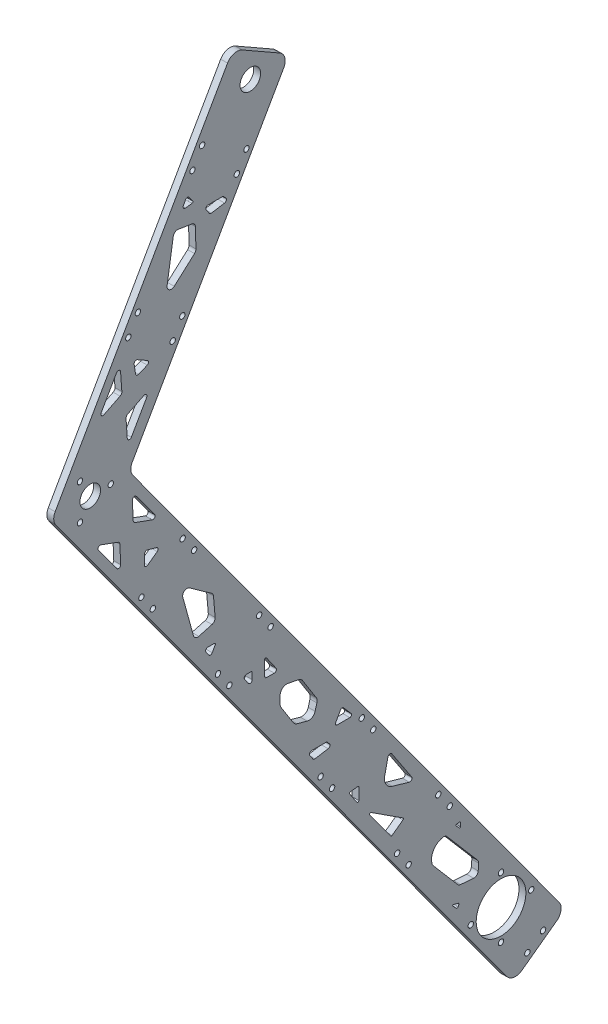
from build123d import *

# Parameters (mm, degrees)
SKETCH3_R                           = 4.765
SKETCH3_R_2                         = 11.5
BOSS_ROCKER_BASE_DEPTH              = 3.18
SKETCH4_R                           = 1.25
CUT_MOTOR_HOLES_SHAFT_SUPPORT_DEPTH = 3.18
SKETCH5_R                           = 1.25
CUT_SUPPORT_HOLES_DEPTH             = 3.18
CUT_LIGHTENING_HOLES_DEPTH          = 3.18


with BuildPart() as part:
    # Sketch3 → Boss-rocker base (new body)
    with BuildSketch(Plane.YZ):
        with BuildLine():
            Line((-3.626649793, 206.112706863), (-289.03382674, -2.652716496))
            ThreePointArc((-289.03382674, -2.652716496), (-291.022843538, -5.922039532), (-290.117530314, -9.640247287))
            Line((-290.117530314, -9.640247287), (-278.309875879, -25.782716018))
            ThreePointArc((-278.309875879, -25.782716018), (-275.040552842, -27.771732816), (-271.322345088, -26.866419592))
            Line((-271.322345088, -26.866419592), (-1.602441241, 170.424309102))
            ThreePointArc((-1.602441241, 170.424309102), (1.066332673, 171.380668673), (3.826130086, 170.732211983))
            Line((3.826130086, 170.732211983), (126.91354691, 100.548260636))
            ThreePointArc((126.91354691, 100.548260636), (130.710275653, 100.069186741), (133.733724692, 102.415122982))
            Line((133.733724692, 102.415122982), (143.640355564, 119.789203239))
            ThreePointArc((143.640355564, 119.789203239), (144.119429459, 123.585931982), (141.773493218, 126.609381021))
            Line((141.773493218, 126.609381021), (1.801921534, 206.420609744))
            ThreePointArc((1.801921534, 206.420609744), (-0.957875878, 207.069066434), (-3.626649793, 206.112706863))
        make_face()
        with Locations((0, 190.180957093)):
            Circle(SKETCH3_R, mode=Mode.SUBTRACT)
        with Locations((-260, 0)):
            Circle(SKETCH3_R_2, mode=Mode.SUBTRACT)
        with Locations((130, 116.055478547)):
            Circle(SKETCH3_R, mode=Mode.SUBTRACT)
    extrude(amount=BOSS_ROCKER_BASE_DEPTH)

    # Sketch4 → Cut-motor holes + shaft support (cut)
    with BuildSketch(Plane.YZ):
        with Locations((-260, -14)):
            Circle(SKETCH4_R)
        with Locations((-260, 14)):
            Circle(SKETCH4_R)
        with Locations((-274, 0)):
            Circle(SKETCH4_R)
        with Locations((-246, 0)):
            Circle(SKETCH4_R)
        with Locations((0, 180.656752709)):
            Circle(SKETCH4_R)
        with Locations((-8.24, 194.928851363)):
            Circle(SKETCH4_R)
        with Locations((8.24, 194.928851363)):
            Circle(SKETCH4_R)
    extrude(amount=CUT_MOTOR_HOLES_SHAFT_SUPPORT_DEPTH, mode=Mode.SUBTRACT)

    # Sketch5 → Cut-support holes (cut)
    with BuildSketch(Plane.YZ):
        with Locations((-173.097097557, 78.211050768)):
            Circle(SKETCH5_R)
        with Locations((-165.832986628, 83.524495264)):
            Circle(SKETCH5_R)
        with Locations((-159.140450015, 59.130652728)):
            Circle(SKETCH5_R)
        with Locations((-151.876339086, 64.444097223)):
            Circle(SKETCH5_R)
        with Locations((-86.902902443, 111.969906325)):
            Circle(SKETCH5_R)
        with Locations((-94.167013372, 106.656461829)):
            Circle(SKETCH5_R)
        with Locations((-100.859549985, 131.050304365)):
            Circle(SKETCH5_R)
        with Locations((-108.123660914, 125.73685987)):
            Circle(SKETCH5_R)
        with Locations((-221.524503751, 42.788087462)):
            Circle(SKETCH5_R)
        with Locations((-214.260392822, 48.101531958)):
            Circle(SKETCH5_R)
        with Locations((-200.30374528, 29.021133918)):
            Circle(SKETCH5_R)
        with Locations((-207.567856209, 23.707689422)):
            Circle(SKETCH5_R)
        with Locations((-38.475496249, 147.392869631)):
            Circle(SKETCH5_R)
        with Locations((-45.739607178, 142.079425135)):
            Circle(SKETCH5_R)
        with Locations((-59.69625472, 161.159823175)):
            Circle(SKETCH5_R)
        with Locations((-52.432143791, 166.473267671)):
            Circle(SKETCH5_R)
        with Locations((95.189202735, 122.297979862)):
            Circle(SKETCH5_R)
        with Locations((103.007538851, 117.839995969)):
            Circle(SKETCH5_R)
        with Locations((114.717176541, 138.376158833)):
            Circle(SKETCH5_R)
        with Locations((106.898840426, 142.834142725)):
            Circle(SKETCH5_R)
        with Locations((62.594935771, 168.096051448)):
            Circle(SKETCH5_R)
        with Locations((50.885298081, 147.559888585)):
            Circle(SKETCH5_R)
        with Locations((43.066961965, 152.017872477)):
            Circle(SKETCH5_R)
        with Locations((54.776599656, 172.554035341)):
            Circle(SKETCH5_R)
        with Locations((-284.303772817, -12.202009133)):
            Circle(SKETCH5_R)
        with Locations((-278.990328321, -19.466120062)):
            Circle(SKETCH5_R)
    extrude(amount=CUT_SUPPORT_HOLES_DEPTH, mode=Mode.SUBTRACT)

    # Sketch6 → Cut-lightening holes (cut)
    with BuildSketch(Plane.YZ):
        with BuildLine():
            Line((-10.769787121, 168.850828722), (-22.35849324, 160.358178067))
            ThreePointArc((-22.35849324, 160.358178067), (-23.549370942, 160.364603578), (-23.889631154, 161.505854634))
            Line((-23.889631154, 161.505854634), (-21.056425779, 169.314282813))
            ThreePointArc((-21.056425779, 169.314282813), (-20.533401198, 170.012282567), (-19.71045993, 170.301291285))
            Line((-19.71045993, 170.301291285), (-11.403614469, 170.656510937))
            ThreePointArc((-11.403614469, 170.656510937), (-10.417332829, 169.988630178), (-10.769787121, 168.850828722))
        make_face()
        with BuildLine():
            Line((-79.983471427, 142.368791683), (-61.979782767, 147.316428458))
            ThreePointArc((-61.979782767, 147.316428458), (-59.811067724, 146.534457497), (-59.819745898, 144.229088067))
            Line((-59.819745898, 144.229088067), (-67.122963599, 133.95613022))
            ThreePointArc((-67.122963599, 133.95613022), (-67.760393878, 133.378682327), (-68.581402, 133.122344477))
            Line((-68.581402, 133.122344477), (-77.604831251, 132.34516891))
            ThreePointArc((-77.604831251, 132.34516891), (-78.919471752, 132.69660063), (-79.704956379, 133.807815192))
            Line((-79.704956379, 133.807815192), (-81.381998087, 139.910311831))
            ThreePointArc((-81.381998087, 139.910311831), (-81.191902606, 141.429196112), (-79.983471427, 142.368791683))
        make_face()
        with BuildLine():
            Line((-23.590243446, 186.37791816), (-35.194117114, 177.906003349))
            ThreePointArc((-35.194117114, 177.906003349), (-35.548706119, 176.769122694), (-34.564130708, 176.099165796))
            Line((-34.564130708, 176.099165796), (-26.264347501, 176.434131554))
            ThreePointArc((-26.264347501, 176.434131554), (-25.440715053, 176.72116458), (-24.916016948, 177.417907193))
            Line((-24.916016948, 177.417907193), (-22.061370004, 185.226931033))
            ThreePointArc((-22.061370004, 185.226931033), (-22.399134797, 186.36917931), (-23.590243446, 186.37791816))
        make_face()
        with BuildLine():
            Line((-41.006254979, 163.554066473), (-37.796701938, 159.166225528))
            ThreePointArc((-37.796701938, 159.166225528), (-36.810829246, 158.772713589), (-36.026370609, 159.48785082))
            Line((-36.026370609, 159.48785082), (-34.845722085, 163.719212835))
            ThreePointArc((-34.845722085, 163.719212835), (-35.001806541, 164.578352986), (-35.773309829, 164.987335665))
            Line((-35.773309829, 164.987335665), (-40.163511394, 165.143814596))
            ThreePointArc((-40.163511394, 165.143814596), (-41.082663718, 164.612819663), (-41.006254979, 163.554066473))
        make_face()
        with BuildLine():
            Line((-89.370674465, 136.583707549), (-91.116796619, 135.414780442))
            ThreePointArc((-91.116796619, 135.414780442), (-91.559865615, 134.548155622), (-91.056187767, 133.715294686))
            Line((-91.056187767, 133.715294686), (-88.562222197, 132.291893426))
            ThreePointArc((-88.562222197, 132.291893426), (-88.063302805, 132.293754391), (-87.814378781, 132.726144093))
            Line((-87.814378781, 132.726144093), (-87.814378781, 135.752723126))
            ThreePointArc((-87.814378781, 135.752723126), (-88.343366936, 136.634850012), (-89.370674465, 136.583707549))
        make_face()
        with BuildLine():
            Line((-123.842513182, 102.258163939), (-127.383477271, 102.258163939))
            ThreePointArc((-127.383477271, 102.258163939), (-128.217930269, 102.139776022), (-128.986523832, 101.793956069))
            Line((-128.986523832, 101.793956069), (-137.87452461, 96.175246667))
            ThreePointArc((-137.87452461, 96.175246667), (-138.681600876, 95.425877769), (-139.163866001, 94.435753436))
            Line((-139.163866001, 94.435753436), (-140.452603638, 89.754685534))
            ThreePointArc((-140.452603638, 89.754685534), (-140.168511172, 87.476227852), (-138.356514585, 86.065998684))
            Line((-138.356514585, 86.065998684), (-135.427175254, 85.259526758))
            ThreePointArc((-135.427175254, 85.259526758), (-134.189854142, 85.184508534), (-133.027829794, 85.61612258))
            Line((-133.027829794, 85.61612258), (-123.19292846, 91.833432183))
            ThreePointArc((-123.19292846, 91.833432183), (-122.319685125, 92.675710701), (-121.851449189, 93.794970338))
            Line((-121.851449189, 93.794970338), (-120.89798735, 98.683909964))
            ThreePointArc((-120.89798735, 98.683909964), (-121.527047578, 101.165680397), (-123.842513182, 102.258163939))
        make_face()
        with BuildLine():
            Line((-109.235164963, 118.721689223), (-111.687084535, 117.014102379))
            ThreePointArc((-111.687084535, 117.014102379), (-112.069688894, 115.894001736), (-111.115590781, 115.193495963))
            Line((-111.115590781, 115.193495963), (-108.16367121, 115.193495963))
            ThreePointArc((-108.16367121, 115.193495963), (-107.810117819, 115.339942572), (-107.66367121, 115.693495963))
            Line((-107.66367121, 115.693495963), (-107.66367121, 117.901082808))
            ThreePointArc((-107.66367121, 117.901082808), (-108.200796364, 118.787506452), (-109.235164963, 118.721689223))
        make_face()
        with BuildLine():
            Line((-105.726824548, 108.545774567), (-112.034458816, 104.152957845))
            ThreePointArc((-112.034458816, 104.152957845), (-113.068827416, 104.087140616), (-113.60595257, 104.973564261))
            Line((-113.60595257, 104.973564261), (-113.60595257, 108.456077775))
            ThreePointArc((-113.60595257, 108.456077775), (-113.313059351, 109.163184556), (-112.60595257, 109.456077775))
            Line((-112.60595257, 109.456077775), (-106.012571425, 109.456077775))
            ThreePointArc((-106.012571425, 109.456077775), (-105.535522369, 109.105824889), (-105.726824548, 108.545774567))
        make_face()
        with BuildLine():
            Line((-179.558789689, 70.020131058), (-184.523139675, 66.737254454))
            ThreePointArc((-184.523139675, 66.737254454), (-184.72615933, 66.176198305), (-184.24734383, 65.820197322))
            Line((-184.24734383, 65.820197322), (-178.884020859, 65.820197322))
            ThreePointArc((-178.884020859, 65.820197322), (-178.50974759, 65.988656192), (-178.38767293, 66.38051924))
            Line((-178.38767293, 66.38051924), (-178.786645915, 69.663395844))
            ThreePointArc((-178.786645915, 69.663395844), (-179.073289746, 70.056972804), (-179.558789689, 70.020131058))
        make_face()
        with BuildLine():
            Line((-173.179518759, 50.529751316), (-187.062617136, 41.348992712))
            ThreePointArc((-187.062617136, 41.348992712), (-188.206182034, 41.377149334), (-188.575130176, 42.459928509))
            Line((-188.575130176, 42.459928509), (-186.300929891, 50.354284082))
            ThreePointArc((-186.300929891, 50.354284082), (-184.055505641, 53.265590831), (-180.426317386, 53.854343461))
            Line((-180.426317386, 53.854343461), (-173.517109299, 52.340698989))
            ThreePointArc((-173.517109299, 52.340698989), (-172.74804587, 51.547125046), (-173.179518759, 50.529751316))
        make_face()
        with BuildLine():
            Line((-192.631698425, 60.807138256), (-205.83829677, 51.146970897))
            ThreePointArc((-205.83829677, 51.146970897), (-206.03719845, 50.820038593), (-205.946667128, 50.448217818))
            Line((-205.946667128, 50.448217818), (-202.259856899, 45.407909503))
            ThreePointArc((-202.259856899, 45.407909503), (-201.842082536, 45.203302904), (-201.436610598, 45.431319977))
            Line((-201.436610598, 45.431319977), (-191.91682248, 60.131795651))
            ThreePointArc((-191.91682248, 60.131795651), (-191.993146395, 60.767036922), (-192.631698425, 60.807138256))
        make_face()
        with BuildLine():
            Line((-154.874496589, 88.49279264), (-156.945885214, 87.11186689))
            ThreePointArc((-156.945885214, 87.11186689), (-157.308056371, 86.678999413), (-157.378165311, 86.118975363))
            Line((-157.378165311, 86.118975363), (-156.383483264, 80.015244624))
            ThreePointArc((-156.383483264, 80.015244624), (-155.736790272, 79.235764341), (-154.741030112, 79.420867127))
            Line((-154.741030112, 79.420867127), (-153.664323533, 80.355367177))
            ThreePointArc((-153.664323533, 80.355367177), (-153.409996179, 80.695539439), (-153.319796393, 81.110585906))
            Line((-153.319796393, 81.110585906), (-153.319796393, 87.660742346))
            ThreePointArc((-153.319796393, 87.660742346), (-153.847938467, 88.542416945), (-154.874496589, 88.49279264))
        make_face()
        with BuildLine():
            Line((-143.504495682, 72.946475235), (-147.601862544, 69.390270035))
            ThreePointArc((-147.601862544, 69.390270035), (-148.458278006, 69.266604847), (-148.926240832, 69.994445019))
            Line((-148.926240832, 69.994445019), (-148.926240832, 75.884018058))
            ThreePointArc((-148.926240832, 75.884018058), (-148.52829084, 76.575650758), (-147.730351354, 76.579195389))
            Line((-147.730351354, 76.579195389), (-143.632984493, 74.24582755))
            ThreePointArc((-143.632984493, 74.24582755), (-143.232756956, 73.629375694), (-143.504495682, 72.946475235))
        make_face()
        with BuildLine():
            Line((-227.536912906, 31.443521835), (-240.812092581, 20.074883922))
            ThreePointArc((-240.812092581, 20.074883922), (-241.294394217, 19.461411125), (-241.505216951, 18.71006732))
            Line((-241.505216951, 18.71006732), (-241.969357294, 12.71062362))
            ThreePointArc((-241.969357294, 12.71062362), (-241.494399162, 11.255439603), (-240.129582559, 10.562315233))
            Line((-240.129582559, 10.562315233), (-237.156438151, 10.332301196))
            ThreePointArc((-237.156438151, 10.332301196), (-236.381608619, 10.425053213), (-235.701254134, 10.807259329))
            Line((-235.701254134, 10.807259329), (-219.133655325, 24.995468947))
            ThreePointArc((-219.133655325, 24.995468947), (-218.552793599, 25.837124808), (-218.463915883, 26.855891554))
            ThreePointArc((-218.463915883, 26.855891554), (-221.531743706, 31.287956059), (-226.896432107, 31.812247659))
            ThreePointArc((-226.896432107, 31.812247659), (-227.233851743, 31.657725269), (-227.536912906, 31.443521835))
        make_face()
        with BuildLine():
            Line((-248.393612971, 22.29474187), (-250.022544898, 20.665809944))
            ThreePointArc((-250.022544898, 20.665809944), (-250.160762634, 20.22191742), (-249.873805448, 19.856130201))
            Line((-249.873805448, 19.856130201), (-249.111541751, 19.513851727))
            ThreePointArc((-249.111541751, 19.513851727), (-248.687507787, 19.52059786), (-248.421180982, 19.850628686))
            Line((-248.421180982, 19.850628686), (-247.89015284, 22.0110002))
            ThreePointArc((-247.89015284, 22.0110002), (-248.034187563, 22.343961442), (-248.393612971, 22.29474187))
        make_face()
        with BuildLine():
            Line((-216.935181556, 20.829053028), (-218.506768223, 19.257466361))
            ThreePointArc((-218.506768223, 19.257466361), (-218.571800048, 18.930529297), (-218.294636189, 18.745334327))
            Line((-218.294636189, 18.745334327), (-216.651140925, 18.745334327))
            ThreePointArc((-216.651140925, 18.745334327), (-216.264292411, 18.928556444), (-216.160960712, 19.343941418))
            Line((-216.160960712, 19.343941418), (-216.428941394, 20.676085248))
            ThreePointArc((-216.428941394, 20.676085248), (-216.63627507, 20.904097237), (-216.935181556, 20.829053028))
        make_face()
        with BuildLine():
            Line((93.747839596, 143.024163005), (93.405611769, 146.031331234))
            ThreePointArc((93.405611769, 146.031331234), (93.831461547, 146.967615527), (94.857963383, 147.032962982))
            Line((94.857963383, 147.032962982), (96.725062305, 146.068973991))
            ThreePointArc((96.725062305, 146.068973991), (97.263282559, 145.258006869), (96.857010058, 144.373534502))
            Line((96.857010058, 144.373534502), (94.539989279, 142.677259135))
            ThreePointArc((94.539989279, 142.677259135), (94.044059253, 142.622693282), (93.747839596, 143.024163005))
        make_face()
        with BuildLine():
            Line((85.568117513, 143.181930885), (86.544369033, 149.434919538))
            ThreePointArc((86.544369033, 149.434919538), (86.183746182, 150.922567652), (84.87682125, 151.719494858))
            Line((84.87682125, 151.719494858), (66.429148509, 154.599648582))
            ThreePointArc((66.429148509, 154.599648582), (64.362763101, 153.577467158), (64.632063287, 151.28786437))
            Line((64.632063287, 151.28786437), (73.050048081, 141.906596667))
            ThreePointArc((73.050048081, 141.906596667), (73.74868466, 141.404929088), (74.593412473, 141.243070035))
            Line((74.593412473, 141.243070035), (83.646848899, 141.491195361))
            ThreePointArc((83.646848899, 141.491195361), (84.913320183, 141.989025039), (85.568117513, 143.181930885))
        make_face()
        with BuildLine():
            Line((14.02466099, 171.152994101), (26.499342742, 164.025193609))
            ThreePointArc((26.499342742, 164.025193609), (27.681856253, 164.166235385), (27.890888241, 165.33864172))
            Line((27.890888241, 165.33864172), (24.192922162, 172.776628693))
            ThreePointArc((24.192922162, 172.776628693), (23.594326249, 173.411011307), (22.743983458, 173.605113104))
            Line((22.743983458, 173.605113104), (14.450247353, 173.018765153))
            ThreePointArc((14.450247353, 173.018765153), (13.545811221, 172.243644861), (14.02466099, 171.152994101))
        make_face()
        with BuildLine():
            Line((43.754076345, 168.361583713), (41.061258952, 163.638966497))
            ThreePointArc((41.061258952, 163.638966497), (40.126205126, 163.136501617), (39.265914045, 163.758350367))
            Line((39.265914045, 163.758350367), (37.614379918, 167.829073947))
            ThreePointArc((37.614379918, 167.829073947), (37.6723168, 168.700353164), (38.392626727, 169.193949927))
            Line((38.392626727, 169.193949927), (42.736978247, 169.845843563))
            ThreePointArc((42.736978247, 169.845843563), (43.710277432, 169.422186498), (43.754076345, 168.361583713))
        make_face()
        with BuildLine():
            Line((33.137619272, 176.360969246), (29.418281786, 183.797123573))
            ThreePointArc((29.418281786, 183.797123573), (29.624721599, 184.970238565), (30.807202998, 185.113604958))
            Line((30.807202998, 185.113604958), (43.294610334, 178.008122379))
            ThreePointArc((43.294610334, 178.008122379), (43.775477006, 176.918627895), (42.872970918, 176.14163771))
            Line((42.872970918, 176.14163771), (34.588541965, 175.53596432))
            ThreePointArc((34.588541965, 175.53596432), (33.737735826, 175.728024943), (33.137619272, 176.360969246))
        make_face()
        with BuildLine():
            Line((89.425255436, 129.07009069), (89.425255436, 135.620247129))
            ThreePointArc((89.425255436, 135.620247129), (88.897113362, 136.501921728), (87.87055524, 136.452297424))
            Line((87.87055524, 136.452297424), (85.799166615, 135.071371674))
            ThreePointArc((85.799166615, 135.071371674), (85.436995458, 134.638504196), (85.366886519, 134.078480146))
            Line((85.366886519, 134.078480146), (86.361568565, 127.974749407))
            ThreePointArc((86.361568565, 127.974749407), (87.008261557, 127.195269124), (88.004021717, 127.38037191))
            Line((88.004021717, 127.38037191), (89.080728296, 128.31487196))
            ThreePointArc((89.080728296, 128.31487196), (89.335055651, 128.655044222), (89.425255436, 129.07009069))
        make_face()
    extrude(amount=CUT_LIGHTENING_HOLES_DEPTH, mode=Mode.SUBTRACT)


solid = part.part
